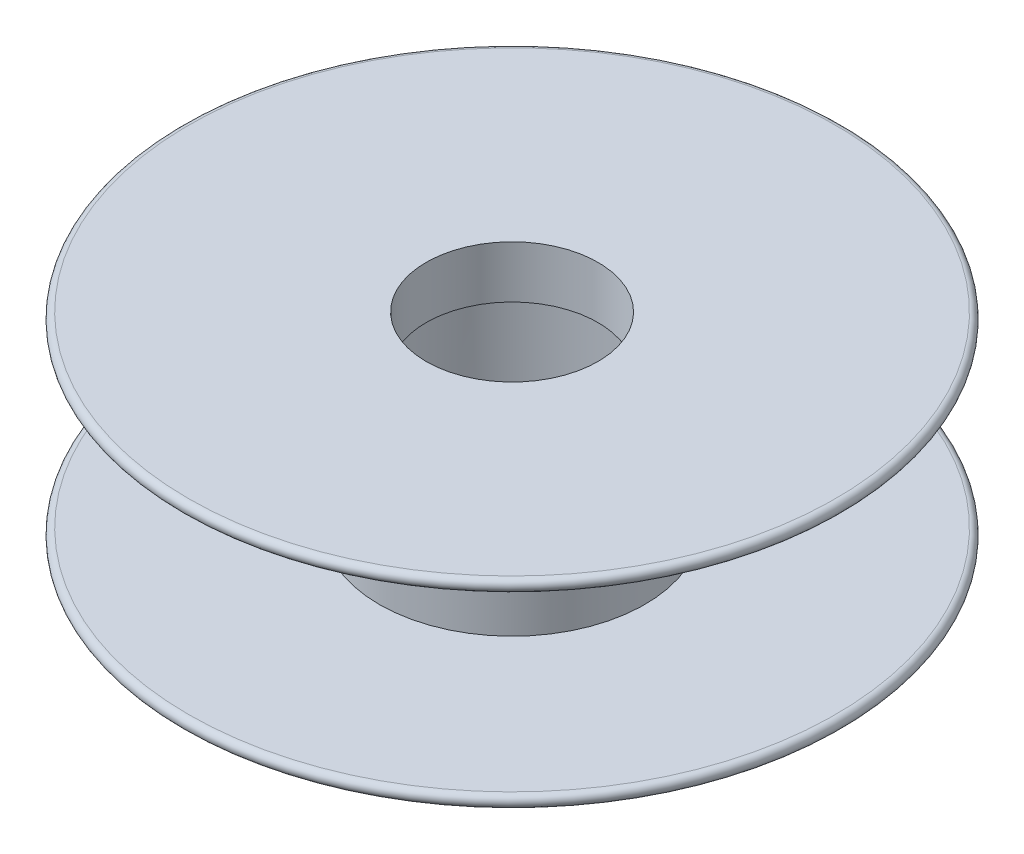
from build123d import *

# Parameters (mm, degrees)
SKETCH1_R           = 99.25
SKETCH1_R_2         = 25.875
BOSS_EXTRUDE1_DEPTH = 3.7
FILLET1_R           = 1.85
SKETCH2_R           = 40
SKETCH2_R_2         = 25.875
BOSS_EXTRUDE2_DEPTH = 12
BOSS_EXTRUDE3_START = 28.6
SKETCH3_R           = 40
SKETCH3_R_2         = 35
BOSS_EXTRUDE3_DEPTH = 28.6


with BuildPart() as part:
    # Sketch1 → Boss-Extrude1 (new body)
    with BuildSketch(Plane(origin=(0, 0, 0), x_dir=(1, 0, 0), z_dir=(0, 1, 0))):
        with Locations(Location((0, 0, 0), (0, 0, 270))):
            Circle(SKETCH1_R)
        with Locations(Location((0, 0, 0), (0, 0, 270))):
            Circle(SKETCH1_R_2, mode=Mode.SUBTRACT)
    extrude(amount=BOSS_EXTRUDE1_DEPTH)

    # Fillet1
    fillet1_edges = [part.edges().sort_by_distance(p)[0] for p in [
        (0, 0, -99.25),
        (0, 3.7, -99.25),
    ]]
    fillet(fillet1_edges, radius=FILLET1_R - 0.0001)  # a hair under: the kernel refuses the full size

    # Sketch2 → Boss-Extrude2 (add)
    with BuildSketch(Plane(origin=(0, 3.7, 0), x_dir=(1, 0, 0), z_dir=(0, 1, 0))):
        with Locations(Location((0, 0, 0), (0, 0, 270))):
            Circle(SKETCH2_R)
        with Locations(Location((0, 0, 0), (0, 0, 270))):
            Circle(SKETCH2_R_2, mode=Mode.SUBTRACT)
    extrude(amount=BOSS_EXTRUDE2_DEPTH)


with BuildPart() as body_2:
    # Mirror2: mirrored copy
    add(part.part.mirror(Plane.ZX.offset(30)))


with BuildPart() as part_1:
    add(part.part)

    add(body_2.part)  # Boss-Extrude3 merges body 2
    # Sketch3 → Boss-Extrude3 (add)
    with BuildSketch(Plane.XZ.offset(-44.3).offset(BOSS_EXTRUDE3_START)):
        with Locations(Location((0, 0, 0), (0, 0, 90))):
            Circle(SKETCH3_R)
        with Locations(Location((0, 0, 0), (0, 0, 90))):
            Circle(SKETCH3_R_2, mode=Mode.SUBTRACT)
    extrude(amount=-BOSS_EXTRUDE3_DEPTH)


solid = part_1.part
